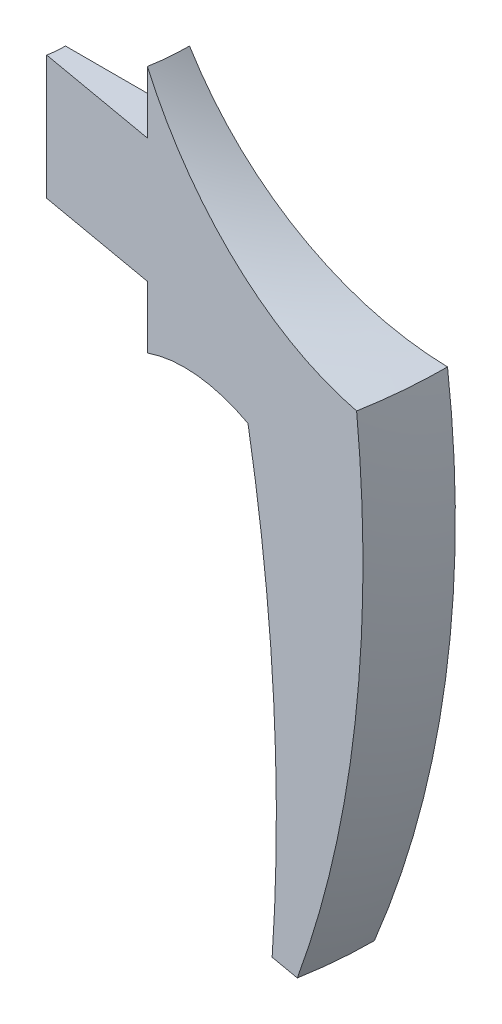
from build123d import *

# Parameters (mm, degrees)
REVOLVE1_ANGLE = 10


with BuildPart() as part:
    # Sketch2 → Revolve1 (revolve)
    with BuildSketch(Plane.XY):
        with BuildLine():
            ThreePointArc((56, -18.250226729), (61.100118063, -53.944497774), (60.795242944, -90))
            Line((60.795242944, -90), (65.795242944, -90))
            ThreePointArc((65.795242944, -90), (77.270130447, -47.769342724), (77.584109665, -4.008596909))
            ThreePointArc((77.584109665, -4.008596909), (53.721414573, 2.677196604), (36, 20))
            Line((36, 20), (36, 10))
            Line((36, 10), (16, 10))
            Line((16, 10), (16, -10))
            Line((16, -10), (36, -10))
            Line((36, -10), (36, -20))
            ThreePointArc((36, -20), (45.849284803, -17.402430783), (56, -18.250226729))
        make_face()
    revolve(axis=Axis((0, 0, 0), (0, -1, 0)), revolution_arc=REVOLVE1_ANGLE)


solid = part.part
